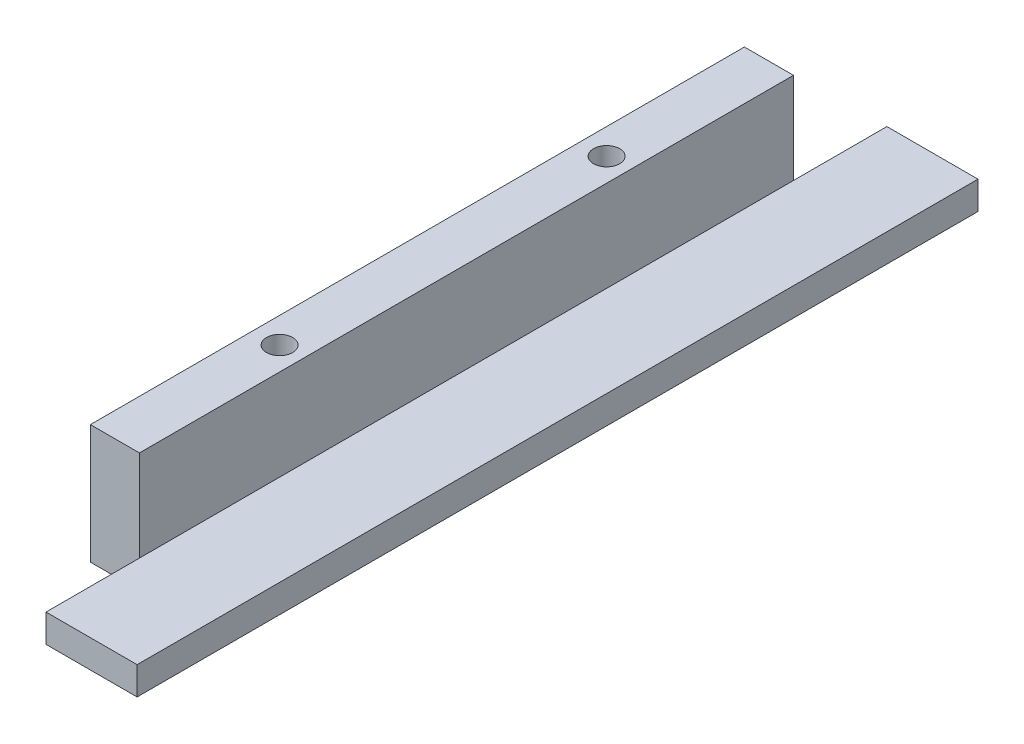
from build123d import *

# Parameters (mm, degrees)
DODANIE_WYCI_GNI_CIE1_DEPTH = 180
SZKIC2_W                    = 10.5
SZKIC2_H                    = 20
WYTNIJ_WYCI_GNI_CIE1_DEPTH  = 183.921602059
SZKIC3_R                    = 2.8
WYTNIJ_WYCI_GNI_CIE2_DEPTH  = 10


with BuildPart() as part:
    # Szkic1 → Dodanie-wyciągnięcie1 (new body)
    with BuildSketch(Plane.XY):
        Polygon((9.75, -15.75), (9.75, -9.75), (-9.75, -9.75), (-9.75, 9.75), (-20.25, 9.75), (-20.25, -15.75), align=None)
    extrude(amount=DODANIE_WYCI_GNI_CIE1_DEPTH)

    # Szkic2 → Wytnij-wyciągnięcie1 (cut, through all)
    with BuildSketch(Plane(origin=(0, 9.75, 0), x_dir=(1, 0, 0), z_dir=(0, 1, 0))):
        with Locations((-15, -170)):
            Rectangle(SZKIC2_W, SZKIC2_H)
    wytnij_wyci_gni_cie1 = extrude(amount=-WYTNIJ_WYCI_GNI_CIE1_DEPTH, mode=Mode.SUBTRACT)

    # Lustro1: Wytnij-wyciągnięcie1 across plane
    add(wytnij_wyci_gni_cie1.mirror(Plane.XY.offset(90)), mode=Mode.SUBTRACT)

    # Szkic3 → Wytnij-wyciągnięcie2 (cut)
    with BuildSketch(Plane(origin=(0, 9.75, 0), x_dir=(1, 0, 0), z_dir=(0, 1, 0))):
        with Locations((-14.75, -55)):
            Circle(SZKIC3_R)
        with Locations((-14.75, -125)):
            Circle(SZKIC3_R)
    extrude(amount=-WYTNIJ_WYCI_GNI_CIE2_DEPTH, mode=Mode.SUBTRACT)


solid = part.part
